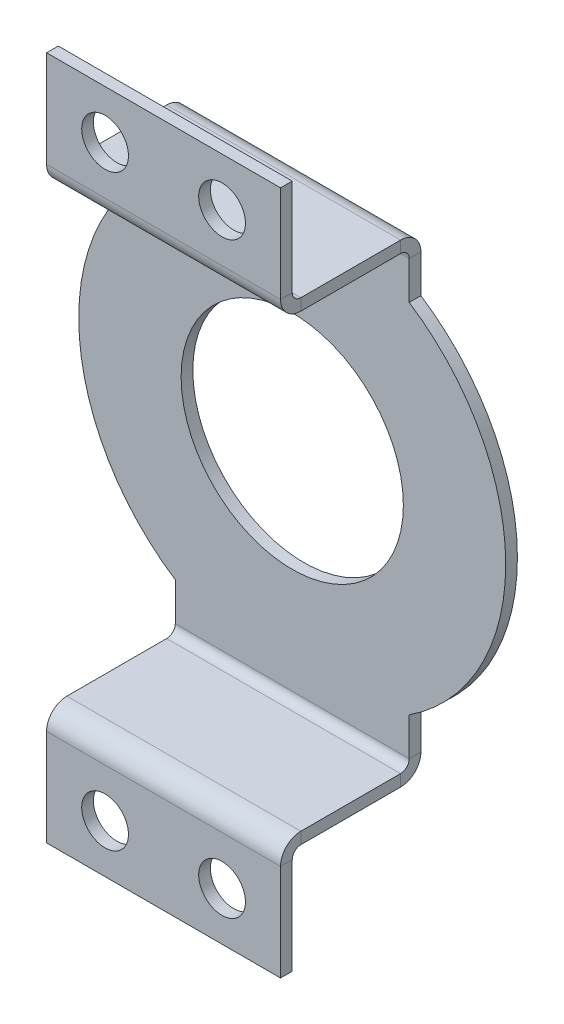
from build123d import *

# Parameters (mm, degrees)
SKETCH_1_R                       = 9.5
SM_BASE_FLANGE_1_DEPTH           = 1
SM_EDGE_FLANGE_1_STRIP_W         = 5.4732
SM_EDGE_FLANGE_1_STRIP_H         = 1
SM_EDGE_FLANGE_1_STRIP_CUT_DEPTH = 20
SM_EDGE_FLANGE_1_DEPTH           = 20
SM_EDGE_FLANGE_2_STRIP_W         = 5.4732
SM_EDGE_FLANGE_2_STRIP_H         = 1
SM_EDGE_FLANGE_2_STRIP_CUT_DEPTH = 20
SM_EDGE_FLANGE_2_DEPTH           = 20
SM_EDGE_FLANGE_3_STRIP_W         = 5.4732
SM_EDGE_FLANGE_3_STRIP_H         = 1
SM_EDGE_FLANGE_3_STRIP_CUT_DEPTH = 20
SM_EDGE_FLANGE_3_DEPTH           = 20
SM_EDGE_FLANGE_4_STRIP_W         = 5.4732
SM_EDGE_FLANGE_4_STRIP_H         = 1
SM_EDGE_FLANGE_4_STRIP_CUT_DEPTH = 20
SM_EDGE_FLANGE_4_DEPTH           = 20
CUT_EXTRUDE_2_DEPTH              = 37.505136625
CUT_EXTRUDE_2_DEPTH_BACK         = 37.505136625
SKETCH_19_R                      = 2


# Sheet-metal steps are written as plain solids
with BuildPart() as part:
    # Sketch 1 → Базовая кромка1 (new body)
    with BuildSketch(Plane.XY):
        with BuildLine():
            Line((-10, 15.266384641), (-10, 20.25))
            Line((-10, 20.25), (10, 20.25))
            Line((10, 20.25), (10, 15.266384641))
            ThreePointArc((10, 15.266384641), (18.25, 0), (10, -15.266384641))
            Line((10, -15.266384641), (10, -20.25))
            Line((10, -20.25), (-10, -20.25))
            Line((-10, -20.25), (-10, -15.266384641))
            ThreePointArc((-10, -15.266384641), (-18.25, 0), (-10, 15.266384641))
        make_face()
        Circle(SKETCH_1_R, mode=Mode.SUBTRACT)
    extrude(amount=-SM_BASE_FLANGE_1_DEPTH)

    # Ребро-кромка1 strip (across the edge) → Ребро-кромка1 strip cut (cut)
    with BuildSketch(Plane(origin=(10, 20.25, 0), x_dir=(0, -1, 0), z_dir=(-1, 0, 0))):
        with Locations((-1, -0.5)):
            Rectangle(SM_EDGE_FLANGE_1_STRIP_W, SM_EDGE_FLANGE_1_STRIP_H)
    extrude(amount=SM_EDGE_FLANGE_1_STRIP_CUT_DEPTH, mode=Mode.SUBTRACT)

    # Ребро-кромка1 section (across the edge) → Ребро-кромка1 (add)
    with BuildSketch(Plane(origin=(10, 20.25, 0), x_dir=(0, -1, 0), z_dir=(-1, 0, 0))):
        with BuildLine():
            Line((0, 0.7366), (0, 11))
            Line((0, 11), (1, 11))
            Line((1, 11), (1, 0.7366))
            ThreePointArc((1, 0.7366), (1.215745145, 0.215745145), (1.7366, 0))
            Line((1.7366, 0), (1.7366, -1))
            ThreePointArc((1.7366, -1), (0.508638364, -0.491361636), (0, 0.7366))
        make_face()
    extrude(amount=SM_EDGE_FLANGE_1_DEPTH)

    # Ребро-кромка2 strip (across the edge) → Ребро-кромка2 strip cut (cut)
    with BuildSketch(Plane(origin=(-10, -20.25, 0), x_dir=(0, 1, 0), z_dir=(1, 0, 0))):
        with Locations((-1, -0.5)):
            Rectangle(SM_EDGE_FLANGE_2_STRIP_W, SM_EDGE_FLANGE_2_STRIP_H)
    extrude(amount=SM_EDGE_FLANGE_2_STRIP_CUT_DEPTH, mode=Mode.SUBTRACT)

    # Ребро-кромка2 section (across the edge) → Ребро-кромка2 (add)
    with BuildSketch(Plane(origin=(-10, -20.25, 0), x_dir=(0, 1, 0), z_dir=(1, 0, 0))):
        with BuildLine():
            Line((0, 0.7366), (0, 11))
            Line((0, 11), (1, 11))
            Line((1, 11), (1, 0.7366))
            ThreePointArc((1, 0.7366), (1.215745145, 0.215745145), (1.7366, 0))
            Line((1.7366, 0), (1.7366, -1))
            ThreePointArc((1.7366, -1), (0.508638364, -0.491361636), (0, 0.7366))
        make_face()
    extrude(amount=SM_EDGE_FLANGE_2_DEPTH)

    # Ребро-кромка3 strip (across the edge) → Ребро-кромка3 strip cut (cut)
    with BuildSketch(Plane(origin=(-10, 20.25, 11), x_dir=(0, 0, -1), z_dir=(1, 0, 0))):
        with Locations((-1, -0.5)):
            Rectangle(SM_EDGE_FLANGE_3_STRIP_W, SM_EDGE_FLANGE_3_STRIP_H)
    extrude(amount=SM_EDGE_FLANGE_3_STRIP_CUT_DEPTH, mode=Mode.SUBTRACT)

    # Ребро-кромка3 section (across the edge) → Ребро-кромка3 (add)
    with BuildSketch(Plane(origin=(-10, 20.25, 11), x_dir=(0, 0, -1), z_dir=(1, 0, 0))):
        with BuildLine():
            Line((0, 0.7366), (0, 9))
            Line((0, 9), (1, 9))
            Line((1, 9), (1, 0.7366))
            ThreePointArc((1, 0.7366), (1.215745145, 0.215745145), (1.7366, 0))
            Line((1.7366, 0), (1.7366, -1))
            ThreePointArc((1.7366, -1), (0.508638364, -0.491361636), (0, 0.7366))
        make_face()
    extrude(amount=SM_EDGE_FLANGE_3_DEPTH)

    # Ребро-кромка4 strip (across the edge) → Ребро-кромка4 strip cut (cut)
    with BuildSketch(Plane(origin=(10, -20.25, 11), x_dir=(0, 0, -1), z_dir=(-1, 0, 0))):
        with Locations((-1, -0.5)):
            Rectangle(SM_EDGE_FLANGE_4_STRIP_W, SM_EDGE_FLANGE_4_STRIP_H)
    extrude(amount=SM_EDGE_FLANGE_4_STRIP_CUT_DEPTH, mode=Mode.SUBTRACT)

    # Ребро-кромка4 section (across the edge) → Ребро-кромка4 (add)
    with BuildSketch(Plane(origin=(10, -20.25, 11), x_dir=(0, 0, -1), z_dir=(-1, 0, 0))):
        with BuildLine():
            Line((0, 0.7366), (0, 9))
            Line((0, 9), (1, 9))
            Line((1, 9), (1, 0.7366))
            ThreePointArc((1, 0.7366), (1.215745145, 0.215745145), (1.7366, 0))
            Line((1.7366, 0), (1.7366, -1))
            ThreePointArc((1.7366, -1), (0.508638364, -0.491361636), (0, 0.7366))
        make_face()
    extrude(amount=SM_EDGE_FLANGE_4_DEPTH)

    # Эскиз19 → Вырез-Вытянуть2 (cut, two sides: drawn at the far end of the back side and taken through both)
    with BuildSketch(Plane.XY.offset(11).offset(-CUT_EXTRUDE_2_DEPTH_BACK)):
        with Locations(Location((-5, 25.1183, 0), (0, 0, 180))):
            Circle(SKETCH_19_R)
        with Locations(Location((5, 25.1183, 0), (0, 0, 180))):
            Circle(SKETCH_19_R)
        with Locations(Location((5, -25.1183, 0), (0, 0, 180))):
            Circle(SKETCH_19_R)
        with Locations(Location((-5, -25.1183, 0), (0, 0, 180))):
            Circle(SKETCH_19_R)
    extrude(amount=CUT_EXTRUDE_2_DEPTH + CUT_EXTRUDE_2_DEPTH_BACK, mode=Mode.SUBTRACT)


solid = part.part
